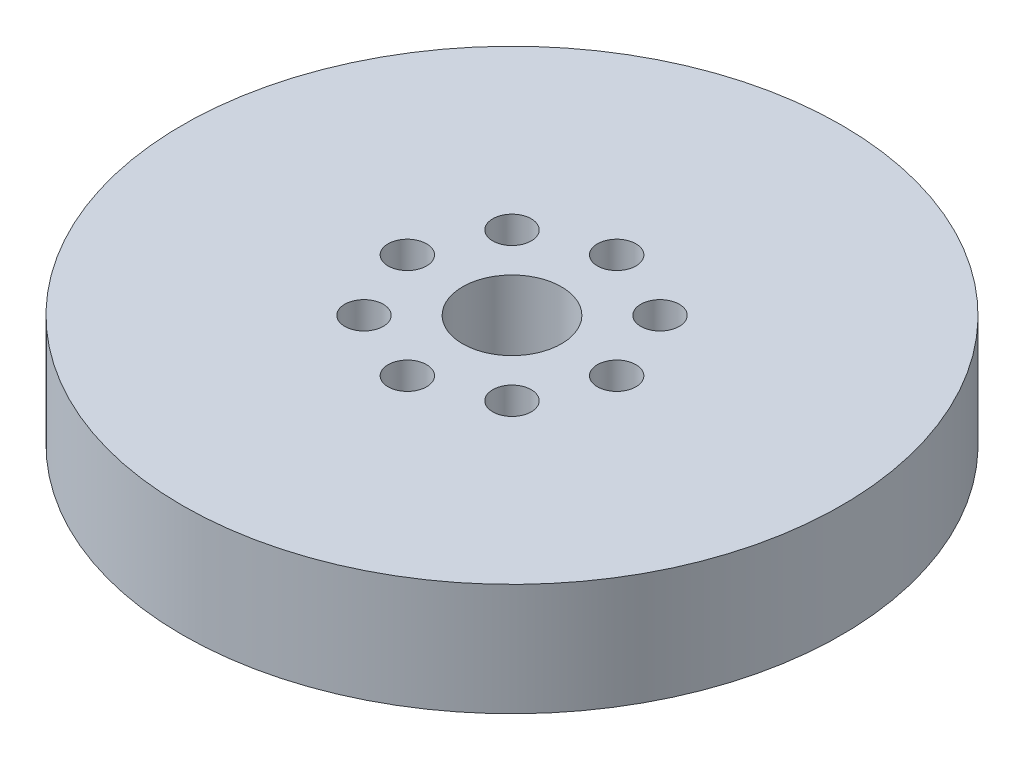
from build123d import *

# Parameters (mm, degrees)
SKETCH1_R           = 50
BOSS_EXTRUDE1_DEPTH = 17
SKETCH2_R           = 7.5
CUT_EXTRUDE1_DEPTH  = 73.725511342
SKETCH3_R           = 2.920212633
CUT_EXTRUDE2_DEPTH  = 10.774794332
CIRPATTERN1_COUNT   = 8


with BuildPart() as part:
    # Sketch1 → Boss-Extrude1 (new body)
    with BuildSketch(Plane(origin=(0, 0, 0), x_dir=(1, 0, 0), z_dir=(0, 1, 0))):
        Circle(SKETCH1_R)
    extrude(amount=BOSS_EXTRUDE1_DEPTH)

    # Sketch2 → Cut-Extrude1 (cut, through all)
    with BuildSketch(Plane(origin=(0, 0, 0), x_dir=(1, 0, 0), z_dir=(0, 1, 0))):
        Circle(SKETCH2_R)
    extrude(amount=CUT_EXTRUDE1_DEPTH, mode=Mode.SUBTRACT)

    # Sketch3 → Cut-Extrude2 (cut)
    with BuildSketch(Plane(origin=(0, 17, 0), x_dir=(1, 0, 0), z_dir=(0, 1, 0))):
        with Locations((-15.879971444, 0)):
            Circle(SKETCH3_R)
    cut_extrude2 = extrude(amount=-CUT_EXTRUDE2_DEPTH, mode=Mode.SUBTRACT)

    # CirPattern1: Cut-Extrude2 ×8 about axis
    cirpattern1_axis = Axis((0, 0, 0), (0, 1, 0))
    for i in range(1, CIRPATTERN1_COUNT):
        add(cut_extrude2.rotate(cirpattern1_axis, i * 360 / CIRPATTERN1_COUNT), mode=Mode.SUBTRACT)


solid = part.part
